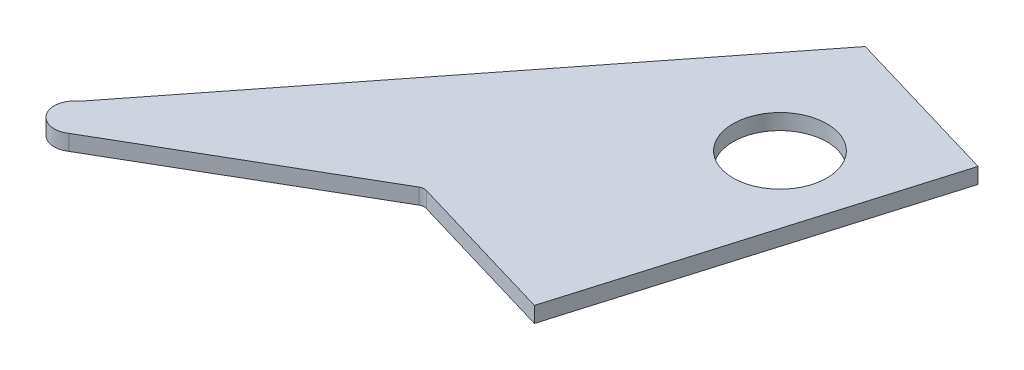
from build123d import *

# Parameters (mm, degrees)
BOSS_EXTRUDE1_DEPTH = 4.7625
SKETCH2_R           = 14.2875
CUT_EXTRUDE1_DEPTH  = 127.195863524


with BuildPart() as part:
    # Sketch1 → Boss-Extrude1 (new body)
    with BuildSketch(Plane(origin=(0, 0, 0), x_dir=(1, 0, 0), z_dir=(0, 1, 0))):
        with BuildLine():
            Line((53.854446853, 73.373362576), (102.562489384, 58.945383065))
            Line((102.562489384, 58.945383065), (71.73313232, -45.132782137))
            Line((71.73313232, -45.132782137), (24.990181224, -31.286889228))
            ThreePointArc((24.990181224, -31.286889228), (23.967852385, -31.200180886), (22.994624733, -31.524992416))
            Line((22.994624733, -31.524992416), (-44.326137807, -70.562582621))
            ThreePointArc((-44.326137807, -70.562582621), (-52.787800823, -69.037356261), (-51.262574464, -60.575693244))
            Line((-51.262574464, -60.575693244), (53.854446853, 73.373362576))
        make_face()
    extrude(amount=BOSS_EXTRUDE1_DEPTH)

    # Sketch2 → Cut-Extrude1 (cut, through all)
    with BuildSketch(Plane(origin=(0, 4.7625, 0), x_dir=(1, 0, 0), z_dir=(0, 1, 0))):
        with Locations((68.361372102, 32.916133793)):
            Circle(SKETCH2_R)
    extrude(amount=-CUT_EXTRUDE1_DEPTH, mode=Mode.SUBTRACT)


solid = part.part
